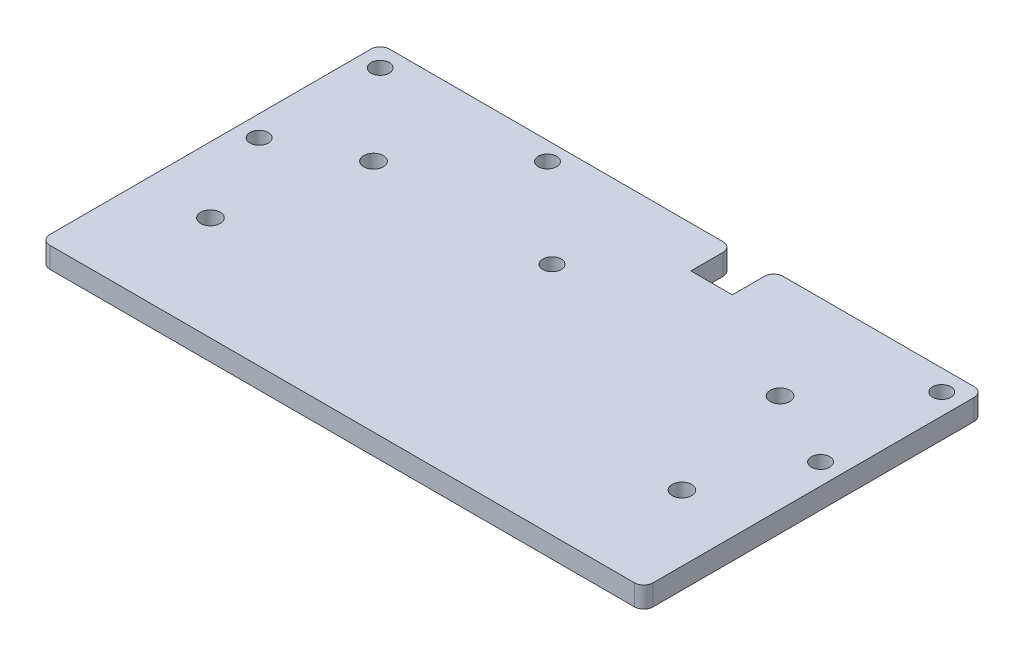
from build123d import *

# Parameters (mm, degrees)
SKETCH1_R           = 1.975
SKETCH1_R_2         = 2.1082
BOSS_EXTRUDE1_DEPTH = 4.5


with BuildPart() as part:
    # Sketch1 → Boss-Extrude1 (new body)
    with BuildSketch(Plane(origin=(0, 0, 0), x_dir=(1, 0, 0), z_dir=(0, 1, 0))):
        with BuildLine():
            Line((63, 20.3), (21.8, 20.3))
            ThreePointArc((21.8, 20.3), (20.385786438, 19.714213562), (19.8, 18.3))
            Line((19.8, 18.3), (19.8, 11.37))
            Line((19.8, 11.37), (10.87, 11.37))
            Line((10.87, 11.37), (10.87, 18.3))
            ThreePointArc((10.87, 18.3), (10.284213562, 19.714213562), (8.87, 20.3))
            Line((8.87, 20.3), (-63, 20.3))
            ThreePointArc((-63, 20.3), (-64.414213562, 19.714213562), (-65, 18.3))
            Line((-65, 18.3), (-65, -50.9))
            ThreePointArc((-65, -50.9), (-64.414213562, -52.314213562), (-63, -52.9))
            Line((-63, -52.9), (63, -52.9))
            ThreePointArc((63, -52.9), (64.414213562, -52.314213562), (65, -50.9))
            Line((65, -50.9), (65, 18.3))
            ThreePointArc((65, 18.3), (64.414213562, 19.714213562), (63, 20.3))
        make_face()
        with Locations((-60.5, 15.8)):
            Circle(SKETCH1_R, mode=Mode.SUBTRACT)
        with Locations((60.5, 15.8)):
            Circle(SKETCH1_R, mode=Mode.SUBTRACT)
        with Locations((60.5, -10.3)):
            Circle(SKETCH1_R, mode=Mode.SUBTRACT)
        with Locations((-60.5, -10.3)):
            Circle(SKETCH1_R, mode=Mode.SUBTRACT)
        with Locations((-25.004260819, 16.35)):
            Circle(SKETCH1_R, mode=Mode.SUBTRACT)
        with Locations((-5.328324842, -2.339651524)):
            Circle(SKETCH1_R, mode=Mode.SUBTRACT)
        with Locations((-50.8, -30.4845)):
            Circle(SKETCH1_R_2, mode=Mode.SUBTRACT)
        with Locations((50.8, -30.4845)):
            Circle(SKETCH1_R_2, mode=Mode.SUBTRACT)
        with Locations((-43.8023, -2.339651524)):
            Circle(SKETCH1_R_2, mode=Mode.SUBTRACT)
        with Locations((43.8023, -2.339651524)):
            Circle(SKETCH1_R_2, mode=Mode.SUBTRACT)
    extrude(amount=BOSS_EXTRUDE1_DEPTH)


solid = part.part
